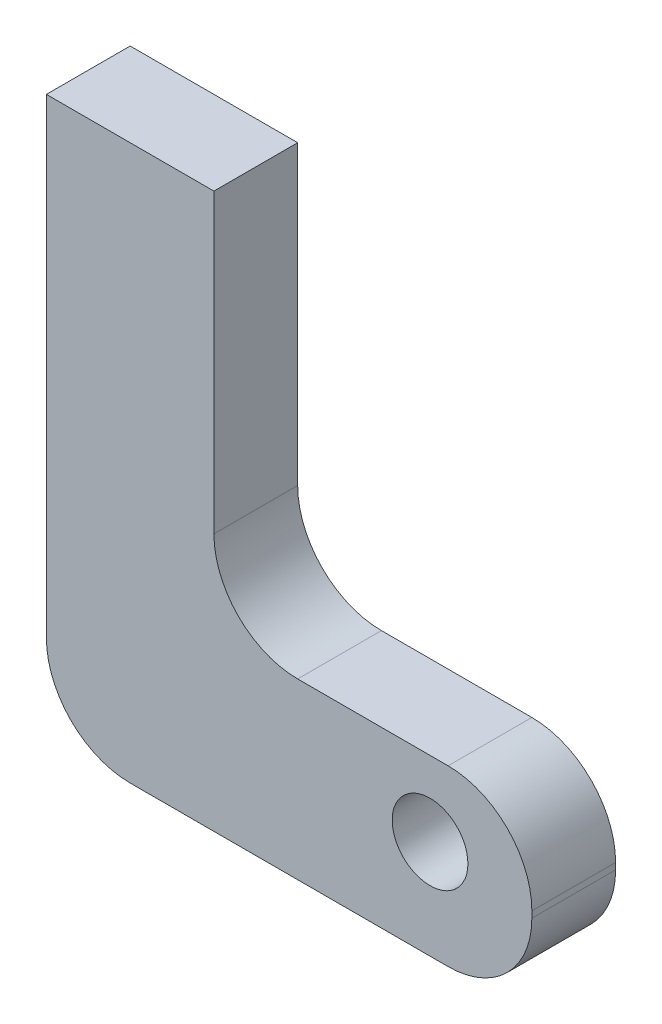
from build123d import *

# Parameters (mm, degrees)
SKETCH1_R           = 2.8702
BOSS_EXTRUDE1_DEPTH = 6.35
FILLET1_R           = 6.35


with BuildPart() as part:
    # Sketch1 → Boss-Extrude1 (new body)
    with BuildSketch(Plane.XY):
        Polygon((113.949884677, 0), (126.649884677, 0), (126.649884677, -6.35), (126.649884677, -28.855984936), (150.753776805, -28.855984936), (150.753776805, -42.040179878), (126.649884677, -42.040179878), (113.949884677, -42.040179878), (113.949884677, -6.35), align=None)
        with Locations((143.035641266, -34.539684717)):
            Circle(SKETCH1_R, mode=Mode.SUBTRACT)
    extrude(amount=BOSS_EXTRUDE1_DEPTH)

    # Fillet1
    fillet1_edges = [part.edges().sort_by_distance(p)[0] for p in [
        (113.949884677, -42.040179878, 3.175),
        (150.753776805, -42.040179878, 3.175),
        (150.753776805, -28.855984936, 3.175),
        (126.649884677, -28.855984936, 3.175),
    ]]
    fillet(fillet1_edges, radius=FILLET1_R)


solid = part.part
